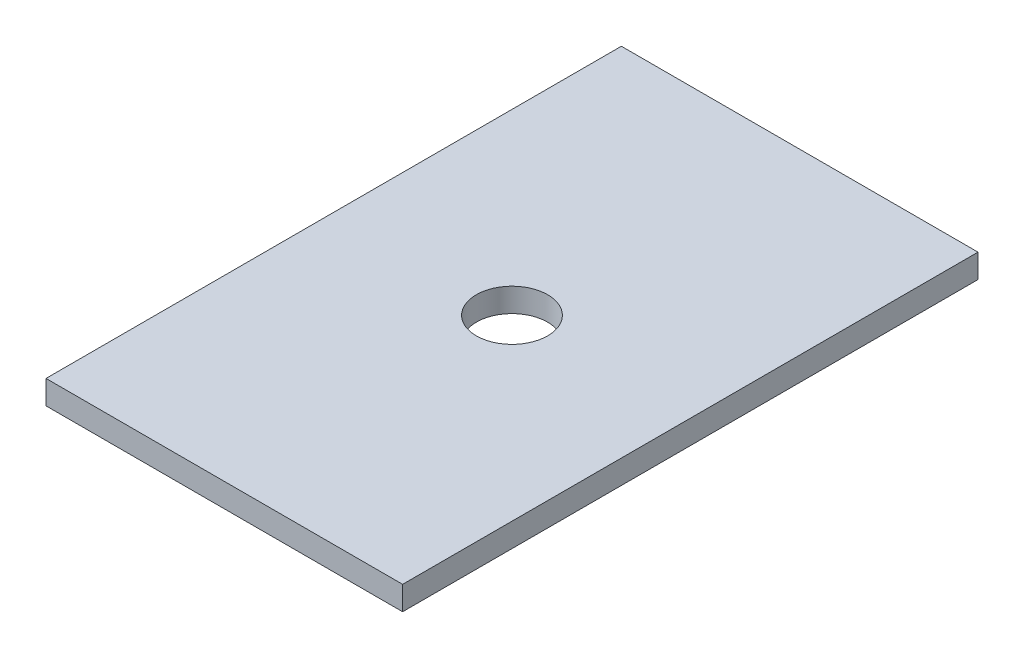
from build123d import *

# Parameters (mm, degrees)
SKETCH2_W           = 150
SKETCH2_H           = 242
SKETCH2_R           = 15
BOSS_EXTRUDE3_DEPTH = 10


with BuildPart() as part:
    # Sketch2 → Boss-Extrude3 (new body)
    with BuildSketch(Plane(origin=(0, 0, 0), x_dir=(1, 0, 0), z_dir=(0, 1, 0))):
        Rectangle(SKETCH2_W, SKETCH2_H)
        Circle(SKETCH2_R, mode=Mode.SUBTRACT)
    extrude(amount=BOSS_EXTRUDE3_DEPTH)


solid = part.part
